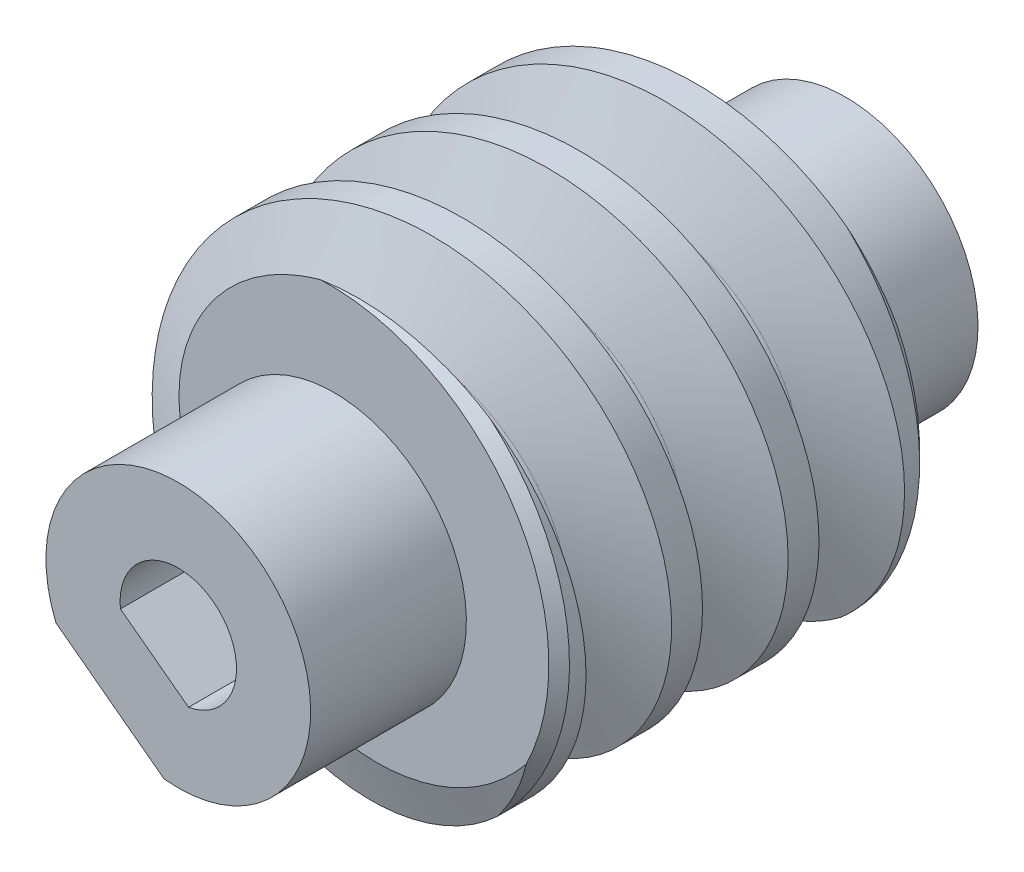
from build123d import *

# Parameters (mm, degrees)
TOOTHCUTWORM01_PITCH = 3.141592606
CUT_EXTRUDE_1_DEPTH  = 14.299624223
EXTRUDE_1_DEPTH      = 3.8
EXTRUDE_1_DEPTH_BACK = 14.2


with BuildPart() as part:
    # SketchRevolveWorm01 → Worm01 (revolve)
    with BuildSketch(Plane(origin=(0, 0, 0), x_dir=(0, 0, -1), z_dir=(1, 0, 0)), mode=Mode.PRIVATE) as worm01_sk:
        Polygon((5, 0), (5, 5.922), (4.722, 6.2), (-4.722, 6.2), (-5, 5.922), (-5, 0), align=None)
    revolve(worm01_sk.sketch.rotate(Axis((0, 0, 0), (0, 0, -1)), 90), axis=Axis((0, 0, 0), (0, 0, -1)))

    # ToothCutWorm01: the profile of SketchToothWorm01 screwed along a right-hand helix of 6 turns, 10 arcs to a turn; built about Z, then put on its axis
    toothcutworm01_z = Axis((0, 0, 0), (0, 0, 1))
    toothcutworm01_corners = [(6.442605973, 0, 1.242827032), (4.139509322, 0, 0.400024681), (3.94260601, 0, 0.118295962), (3.94260601, 0, -0.118295962), (4.139509322, 0, -0.400024681), (6.442605973, 0, -1.242827032)]
    with BuildLine(mode=Mode.PRIVATE) as toothcutworm01_profile:
        Line(toothcutworm01_corners[0], toothcutworm01_corners[1])
        Line(toothcutworm01_corners[2], toothcutworm01_corners[3])
        Line(toothcutworm01_corners[4], toothcutworm01_corners[5])
        Line(toothcutworm01_corners[5], toothcutworm01_corners[0])
        ThreePointArc((4.139509322, 0, 0.400024681), (3.996710701, 0, 0.290154905), (3.94260601, 0, 0.118295962))
        ThreePointArc((3.94260601, 0, -0.118295962), (3.996710701, 0, -0.290154905), (4.139509322, 0, -0.400024681))
    toothcutworm01_cap = Face(toothcutworm01_profile.wire())
    toothcutworm01_arcs = [((4.139509322, 0, 0.400024681), (3.94260601, 0, 0.327969271), (3.94260601, 0, 0.118295962), (1, 0.8196510285854599, 1)), ((3.94260601, 0, -0.118295962), (3.94260601, 0, -0.327969271), (4.139509322, 0, -0.400024681), (1, 0.8196510285854628, 1))]  # start, shoulder, end, weights
    toothcutworm01_turn_angles = [0, 18, 36, 54, 72, 90, 108, 126, 144, 162, 180, 198, 216, 234, 252, 270, 288, 306, 324, 342, 360]
    toothcutworm01_turn_weights = [1, 0.9510565162951535, 1, 0.9510565162951535, 1, 0.9510565162951535, 1, 0.9510565162951535, 1, 0.9510565162951535, 1, 0.9510565162951535, 1, 0.9510565162951535, 1, 0.9510565162951535, 1, 0.9510565162951535, 1, 0.9510565162951535, 1]
    toothcutworm01_turn_rails = [Edge.make_bspline([Vector(p[0], p[1], 0).rotate(toothcutworm01_z, toothcutworm01_turn_angles[k]) / toothcutworm01_turn_weights[k] + Vector(0, 0, p[2] + TOOTHCUTWORM01_PITCH * toothcutworm01_turn_angles[k] / 360) for k in range(21)], [0, 0, 0, 1, 1, 2, 2, 3, 3, 4, 4, 5, 5, 6, 6, 7, 7, 8, 8, 9, 9, 10, 10, 10], 2, toothcutworm01_turn_weights) for p in toothcutworm01_corners]
    toothcutworm01_turn_sides = [*[Face.make_surface_from_curves(toothcutworm01_turn_rails[p[0]], toothcutworm01_turn_rails[p[1]]) for p in [(0, 1), (2, 3), (4, 5), (5, 0)]], *[Face.make_bezier_surface([[Vector(p[j][0], p[j][1], 0).rotate(toothcutworm01_z, toothcutworm01_turn_angles[2 * i + k]) / toothcutworm01_turn_weights[2 * i + k] + Vector(0, 0, p[j][2] + TOOTHCUTWORM01_PITCH * toothcutworm01_turn_angles[2 * i + k] / 360) for k in range(3)] for j in range(3)], [[p[3][j] * toothcutworm01_turn_weights[2 * i + k] for k in range(3)] for j in range(3)]) for p in toothcutworm01_arcs for i in range(10)]]
    toothcutworm01 = Plane(origin=(0, 0, 9.424777819), x_dir=(1, 0, 0), z_dir=(0, 0, -1)) * Solid(Shell([*[p.moved(Location((0, 0, TOOTHCUTWORM01_PITCH * i))) for i in range(6) for p in toothcutworm01_turn_sides], toothcutworm01_cap, toothcutworm01_cap.rotate(toothcutworm01_z, 2160).moved(Location((0, 0, TOOTHCUTWORM01_PITCH * 2160 / 360)))]))
    add(toothcutworm01, mode=Mode.SUBTRACT)

    # Эскиз1 → Вырез-Вытянуть1 (cut, through all)
    with BuildSketch(Plane.XY.offset(5)):
        with BuildLine():
            Line((-1.434416631, -0.269899964), (0.403795225, -1.648659251))
            ThreePointArc((0.403795225, -1.648659251), (1.068763116, 1.152665026), (-1.434416631, -0.269899964))
        make_face()
    extrude(amount=-CUT_EXTRUDE_1_DEPTH, mode=Mode.SUBTRACT)

    # Эскиз2 → Вытянуть-Тонкостенный1 (add, two sides: drawn at the far end of the back side and taken through both)
    with BuildSketch(Plane(origin=(0, 0, -5), x_dir=(-1, 0, 0), z_dir=(0, 0, -1)).offset(-EXTRUDE_1_DEPTH_BACK)):
        with BuildLine():
            Line((3.172997786, -1.465934685), (0.257735467, -3.652540642))
            ThreePointArc((0.257735467, -3.652540642), (-2.26881904, 2.752623081), (3.172997786, -1.465934685))
        make_face()
        with BuildLine():
            Line((1.434416631, -0.269899964), (-0.403795225, -1.648659251))
            ThreePointArc((-0.403795225, -1.648659251), (-1.068763116, 1.152665026), (1.434416631, -0.269899964))
        make_face(mode=Mode.SUBTRACT)
    extrude(amount=EXTRUDE_1_DEPTH + EXTRUDE_1_DEPTH_BACK)


solid = part.part
